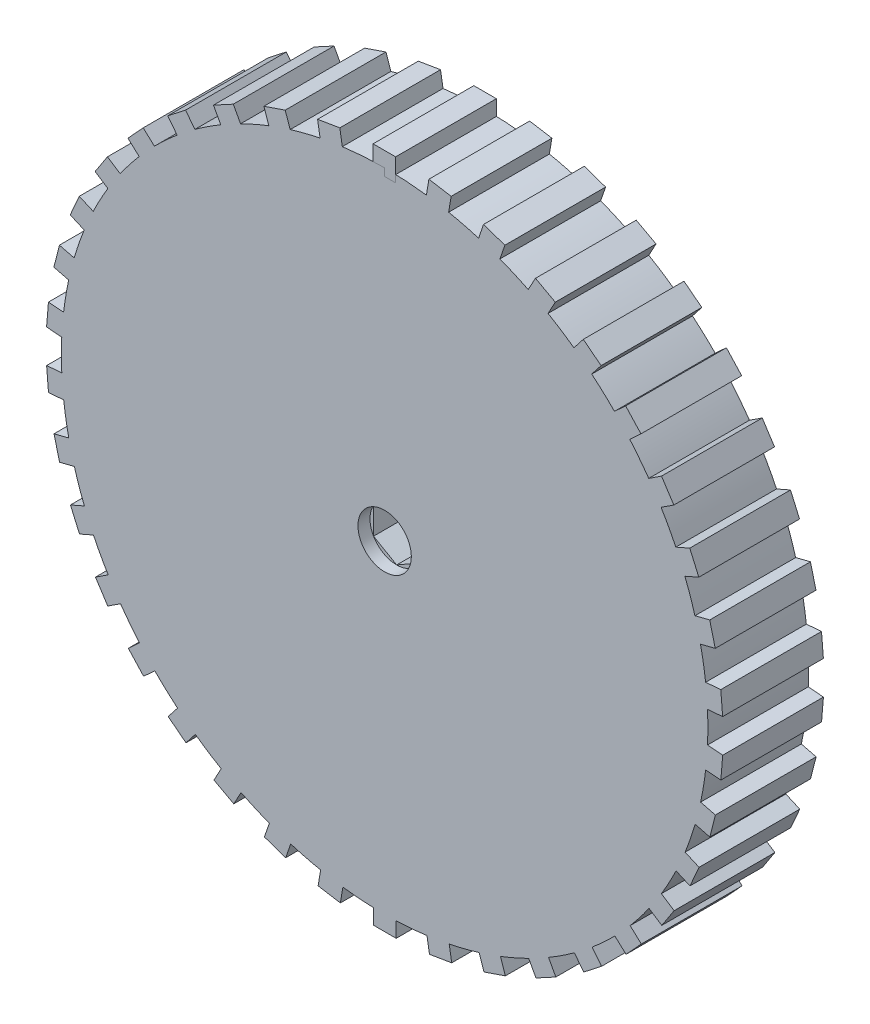
from build123d import *

# Parameters (mm, degrees)
SKETCH1_R           = 43
BOSS_EXTRUDE1_DEPTH = 13.4
CUT_EXTRUDE1_REACH  = 64.27
BOSS_EXTRUDE3_START = 42
SKETCH9_W           = 3
SKETCH9_H           = 13.4
BOSS_EXTRUDE3_DEPTH = 3
CIRPATTERN11_COUNT  = 38
SKETCH12_R          = 38
SKETCH12_R_2        = 7
CUT_EXTRUDE6_DEPTH  = 6.7
SKETCH14_R          = 7.869119163
CUT_EXTRUDE7_DEPTH  = 2
FILLET1_R           = 10
SKETCH15_R          = 3.550704156
CUT_EXTRUDE8_DEPTH  = 1.6


with BuildPart() as part:
    # Sketch1 → Boss-Extrude1 (new body)
    with BuildSketch(Plane.XY):
        Circle(SKETCH1_R)
    extrude(amount=BOSS_EXTRUDE1_DEPTH)

    # Sketch2 → Cut-Extrude1 (cut, up to next)
    with BuildSketch(Plane.XY.offset(13.4), mode=Mode.PRIVATE) as cut_extrude1_sk1:
        Polygon((0, -3.550704156), (3.075, -1.775352078), (3.075, 1.775352078), (0, 3.550704156), (-3.075, 1.775352078), (-3.075, -1.775352078), align=None)
    cut_extrude1_tool1 = extrude(cut_extrude1_sk1.sketch, amount=-CUT_EXTRUDE1_REACH, mode=Mode.PRIVATE) & part.part
    add(cut_extrude1_tool1.solids().sort_by_distance((0, 0, 13.4))[0], mode=Mode.SUBTRACT)


with BuildPart() as body_2:
    # Sketch9 → Boss-Extrude3 (new body)
    with BuildSketch(Plane(origin=(0, 0, 0), x_dir=(1, 0, 0), z_dir=(0, 1, 0)).offset(BOSS_EXTRUDE3_START)):
        with Locations((-0.0375, -6.7)):
            Rectangle(SKETCH9_W, SKETCH9_H)
    boss_extrude3 = extrude(amount=BOSS_EXTRUDE3_DEPTH)


with BuildPart() as part_1:
    add(part.part)

    # CirPattern11: Boss-Extrude3 ×38 about axis
    cirpattern11_axis = Axis((0, 0, 0), (0, 0, 1))
    for i in range(1, CIRPATTERN11_COUNT):
        add(boss_extrude3.rotate(cirpattern11_axis, i * 360 / CIRPATTERN11_COUNT))

    # Sketch12 → Cut-Extrude6 (cut)
    with BuildSketch(Plane(origin=(0, 0, 0), x_dir=(-1, 0, 0), z_dir=(0, 0, -1))):
        Circle(SKETCH12_R)
        Circle(SKETCH12_R_2, mode=Mode.SUBTRACT)
    extrude(amount=-CUT_EXTRUDE6_DEPTH, mode=Mode.SUBTRACT)

    # Sketch14 → Cut-Extrude7 (cut)
    with BuildSketch(Plane(origin=(0, 0, 0), x_dir=(-1, 0, 0), z_dir=(0, 0, -1))):
        Circle(SKETCH14_R)
    extrude(amount=-CUT_EXTRUDE7_DEPTH, mode=Mode.SUBTRACT)

    # Fillet1
    # the kernel refuses this fillet: 10 mm, written as the material it adds along each edge
    with BuildSketch(Plane(origin=(0, 0, 6.7), x_dir=(-1, 0, 0), z_dir=(0, -1, 0))) as fillet1_piece_1:
        with BuildLine():
            CenterArc((28.56019068, 10), FILLET1_R, 270, 70.731224509)
            Line((28.56019068, 0), (28.56019068, -0.2))
            Line((28.56019068, -0.2), (38, -0.2))
            Line((38, -0.2), (38.2, 0))
            ThreePointArc((38.2, 0), (38.2, 3.35), (38.188796186, 6.634))
            Line((38.188796186, 6.634), (38, 6.7))
        make_face()
    revolve(axis=Axis((0, 0, 6.7), (0, 0, -1)))

    # Sketch15 → Cut-Extrude8 (cut)
    with BuildSketch(Plane.XY.offset(13.4)):
        Circle(SKETCH15_R)
    extrude(amount=-CUT_EXTRUDE8_DEPTH, mode=Mode.SUBTRACT)


solid = Compound([body_2.part, part_1.part])
